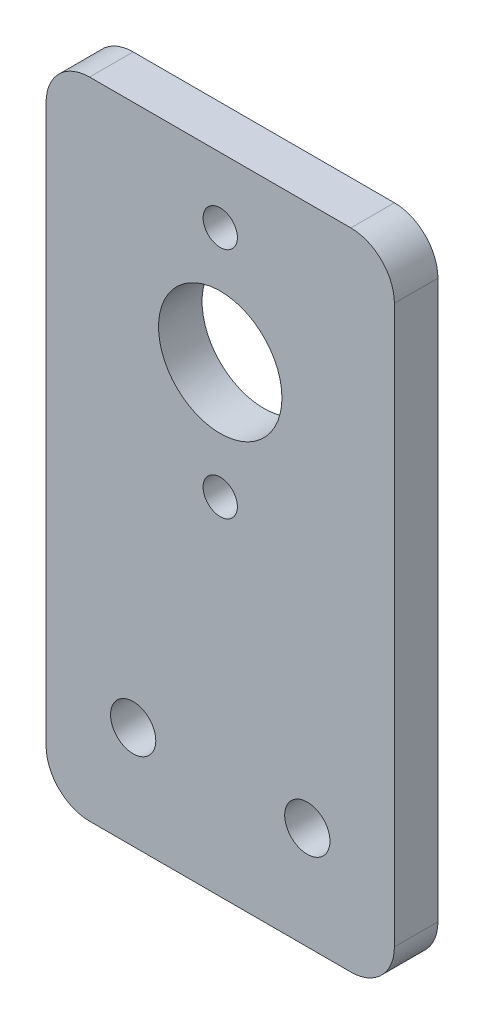
from build123d import *

# Parameters (mm, degrees)
SKETCH1_W             = 25.4
SKETCH1_H             = 47
BOSS_EXTRUDE1_DEPTH   = 3.175
SKETCH2_R             = 4.5
CUT_EXTRUDE1_DEPTH    = 27.90019749
M3X0_5_TAPPED_HOLE1_D = 2.5
FILLET1_R             = 3.175
M4X0_7_TAPPED_HOLE1_D = 3.3


with BuildPart() as part:
    # Sketch1 → Boss-Extrude1 (new body)
    with BuildSketch(Plane.XY):
        Rectangle(SKETCH1_W, SKETCH1_H)
    extrude(amount=BOSS_EXTRUDE1_DEPTH)

    # Sketch2 → Cut-Extrude1 (cut, through all)
    with BuildSketch(Plane.XY.offset(3.175)):
        with Locations((0, 10.25)):
            Circle(SKETCH2_R)
    extrude(amount=-CUT_EXTRUDE1_DEPTH, mode=Mode.SUBTRACT)

    # M3x0.5 Tapped Hole1 (through all)
    with Locations(Plane.XY.offset(3.175)):
        with Locations((0, 18.75), (0, 1.75)):
            Hole(M3X0_5_TAPPED_HOLE1_D / 2)

    # Fillet1
    fillet1_edges = [part.edges().sort_by_distance(p)[0] for p in [
        (-12.7, -23.5, 1.5875),
        (12.7, -23.5, 1.5875),
        (12.7, 23.5, 1.5875),
        (-12.7, 23.5, 1.5875),
    ]]
    fillet(fillet1_edges, radius=FILLET1_R)

    # M4x0.7 Tapped Hole1 (through all)
    with Locations(Plane.XY.offset(3.175)):
        with Locations((-6.35, -16), (6.35, -16)):
            Hole(M4X0_7_TAPPED_HOLE1_D / 2)


solid = part.part
